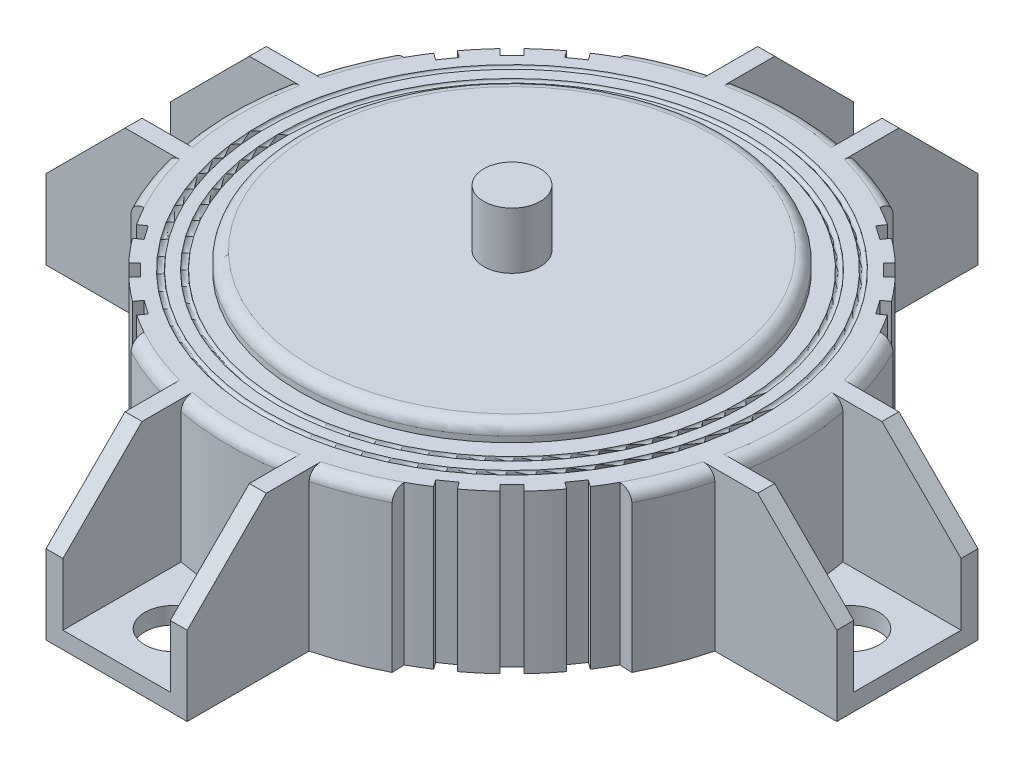
from build123d import *

# Parameters (mm, degrees)
FILLET1_R                    = 2
BOSS_EXTRUDE1_DEPTH          = 70
CHAMFER1_SIZE                = 14
SKETCH3_R                    = 5
CUT_EXTRUDE1_DEPTH           = 3
CIRPATTERN1_COUNT            = 4
CHAMFER1_OF_CIRPATTERN1_SIZE = 14
CUT_EXTRUDE2_START           = 40
CUT_EXTRUDE2_DEPTH           = 40
CUT_EXTRUDE3_DEPTH           = 40
CIRPATTERN3_DEPTH            = 28
CIRPATTERN4_COUNT            = 4
CUT_SWEEP1_PROFILE_R         = 0.5
CUT_SWEEP2_PROFILE_R         = 0.5
CUT_EXTRUDE5_START           = -10
SKETCH20_R                   = 37.5
CUT_EXTRUDE5_DEPTH           = 10


# Read off the part's stored shape, not the designer's step: CirPattern3
with BuildPart() as part:
    # Sketch1 → Revolve1 (revolve)
    with BuildSketch(Plane.XY, mode=Mode.PRIVATE) as revolve1_sk:
        Polygon((0, 0), (-50, 0), (-50, 28), (-37.5, 28), (-37.5, 31), (-5, 31), (-5, 41), (0, 41), align=None)
    revolve(revolve1_sk.sketch.rotate(Axis((0, 0, 0), (0, 1, 0)), 270), axis=Axis((0, 0, 0), (0, 1, 0)))

    # Fillet1
    fillet1_edges = [part.edges().sort_by_distance(p)[0] for p in [
        (0, 31, 37.5),
        (0, 28, 50),
    ]]
    fillet(fillet1_edges, radius=FILLET1_R)

    # Sketch2 → Boss-Extrude1 (add)
    with BuildSketch(Plane.XY):
        Polygon((12.5, 0), (-12.5, 0), (-12.5, 28), (-9.5, 28), (-9.5, 3), (9.5, 3), (9.5, 28), (12.5, 28), align=None)
    boss_extrude1 = extrude(amount=BOSS_EXTRUDE1_DEPTH)

    # Chamfer1
    chamfer1_edges = [part.edges().sort_by_distance(p)[0] for p in [
        (-11, 28, 70),
        (11, 28, 70),
    ]]
    chamfer(chamfer1_edges, length=CHAMFER1_SIZE)

    # Sketch3 → Cut-Extrude1 (cut)
    with BuildSketch(Plane(origin=(0, 0, 0), x_dir=(1, 0, 0), z_dir=(0, 1, 0))):
        with Locations(Location((0, -60, 0), (0, 0, 270))):
            Circle(SKETCH3_R)
    cut_extrude1 = extrude(amount=CUT_EXTRUDE1_DEPTH, mode=Mode.SUBTRACT)

    # CirPattern1: Boss-Extrude1, Cut-Extrude1 ×4 about axis
    cirpattern1_axis = Axis((0, 0, 0), (0, 1, 0))
    add([boss_extrude1.rotate(cirpattern1_axis, i * 360 / CIRPATTERN1_COUNT) for i in range(1, CIRPATTERN1_COUNT)])
    add([cut_extrude1.rotate(cirpattern1_axis, i * 360 / CIRPATTERN1_COUNT) for i in range(1, CIRPATTERN1_COUNT)], mode=Mode.SUBTRACT)

    # Chamfer1 of CirPattern1
    chamfer1_of_cirpattern1_edges = [part.edges().sort_by_distance(p)[0] for p in [
        (70, 28, 11),
        (70, 28, -11),
        (11, 28, -70),
        (-11, 28, -70),
        (-70, 28, -11),
        (-70, 28, 11),
    ]]
    chamfer(chamfer1_of_cirpattern1_edges, length=CHAMFER1_OF_CIRPATTERN1_SIZE)

    # Sketch4 → Cut-Extrude2 (cut)
    with BuildSketch(Plane(origin=(0, 0, 0), x_dir=(1, 0, 0), z_dir=(0, 1, 0)).offset(CUT_EXTRUDE2_START)):
        with BuildLine():
            Line((35.355339059, -35.355339059), (33.941125497, -33.941125497))
            ThreePointArc((33.941125497, -33.941125497), (28.77498914, -38.418745425), (23.02513458, -42.117017672))
            Line((23.02513458, -42.117017672), (23.12024219, -44.333445626))
            ThreePointArc((23.12024219, -44.333445626), (29.580398915, -40.311288741), (35.355339059, -35.355339059))
        make_face()
        with BuildLine():
            ThreePointArc((42.117017672, -23.02513458), (38.418745425, -28.77498914), (33.941125497, -33.941125497))
            Line((33.941125497, -33.941125497), (35.355339059, -35.355339059))
            ThreePointArc((35.355339059, -35.355339059), (40.311288741, -29.580398915), (44.333445626, -23.12024219))
            Line((44.333445626, -23.12024219), (42.117017672, -23.02513458))
        make_face()
    cut_extrude2 = extrude(amount=-CUT_EXTRUDE2_DEPTH, mode=Mode.SUBTRACT)

    # Sketch5 → Cut-Extrude3 (cut)
    with BuildSketch(Plane(origin=(0, 0, 0), x_dir=(1, 0, 0), z_dir=(0, 1, 0))):
        Polygon((33.941125497, -36.062445841), (31.819805153, -33.941125497), (33.941125497, -31.819805153), (36.062445841, -33.941125497), align=None)
    cut_extrude3 = extrude(amount=CUT_EXTRUDE3_DEPTH, mode=Mode.SUBTRACT)

    # CirPattern3 outline → CirPattern3 (cut)
    with BuildSketch(Plane(origin=(0, 0, 0), x_dir=(1, 0, 0), z_dir=(0, 1, 0))):
        with BuildLine():
            Line((27.900032357, -37.230205405), (25.442576224, -38.950934714))
            Line((25.442576224, -38.950934714), (26.289494397, -40.160459215))
            ThreePointArc((26.289494397, -40.160459215), (27.531668945, -39.319298126), (28.74695053, -38.439729906))
            Line((28.74695053, -38.439729906), (27.900032357, -37.230205405))
        make_face()
        with BuildLine():
            Line((38.950934714, -25.442576224), (37.230205405, -27.900032357))
            Line((37.230205405, -27.900032357), (38.439729906, -28.74695053))
            ThreePointArc((38.439729906, -28.74695053), (39.319298126, -27.531668945), (40.160459215, -26.289494397))
            Line((40.160459215, -26.289494397), (38.950934714, -25.442576224))
        make_face()
    cirpattern3 = extrude(amount=CIRPATTERN3_DEPTH, mode=Mode.SUBTRACT)

    # CirPattern4: Cut-Extrude2, Cut-Extrude3, CirPattern3 ×4 about axis
    cirpattern4_axis = Axis((0, 0, 0), (0, 1, 0))
    add([cut_extrude2.rotate(cirpattern4_axis, i * 360 / CIRPATTERN4_COUNT) for i in range(1, CIRPATTERN4_COUNT)], mode=Mode.SUBTRACT)
    add([cut_extrude3.rotate(cirpattern4_axis, i * 360 / CIRPATTERN4_COUNT) for i in range(1, CIRPATTERN4_COUNT)], mode=Mode.SUBTRACT)
    add([cirpattern3.rotate(cirpattern4_axis, i * 360 / CIRPATTERN4_COUNT) for i in range(1, CIRPATTERN4_COUNT)], mode=Mode.SUBTRACT)

    # Cut-Sweep1: sweep along a path in Sketch6
    with BuildLine(Plane(origin=(0, 28, 0), x_dir=(1, 0, 0), z_dir=(0, 1, 0))) as cut_sweep1_path:
        CenterArc((0, 0), 41, 0, 360)
    # Cut-Sweep1 profile (on start of the path) → Cut-Sweep1 (sweep, cut)
    with BuildSketch(Plane(origin=(41, 28, 0), x_dir=(-1, 0, 0), z_dir=(0, 0, -1))):
        Circle(CUT_SWEEP1_PROFILE_R)
    sweep(path=cut_sweep1_path.line, mode=Mode.SUBTRACT)

    # Cut-Sweep2: sweep along a path in Sketch7
    with BuildLine(Plane(origin=(0, 28, 0), x_dir=(1, 0, 0), z_dir=(0, 1, 0))) as cut_sweep2_path:
        CenterArc((0, 0), 44, 0, 360)
    # Cut-Sweep2 profile (on start of the path) → Cut-Sweep2 (sweep, cut)
    with BuildSketch(Plane(origin=(44, 28, 0), x_dir=(-1, 0, 0), z_dir=(0, 0, -1))):
        Circle(CUT_SWEEP2_PROFILE_R)
    sweep(path=cut_sweep2_path.line, mode=Mode.SUBTRACT)

    # Sketch20 → Cut-Extrude5 (cut)
    with BuildSketch(Plane.XZ.offset(CUT_EXTRUDE5_START)):
        with Locations(Location((0, 0, 0), (0, 0, 270))):
            Circle(SKETCH20_R)
    extrude(amount=CUT_EXTRUDE5_DEPTH, mode=Mode.SUBTRACT)


solid = part.part
